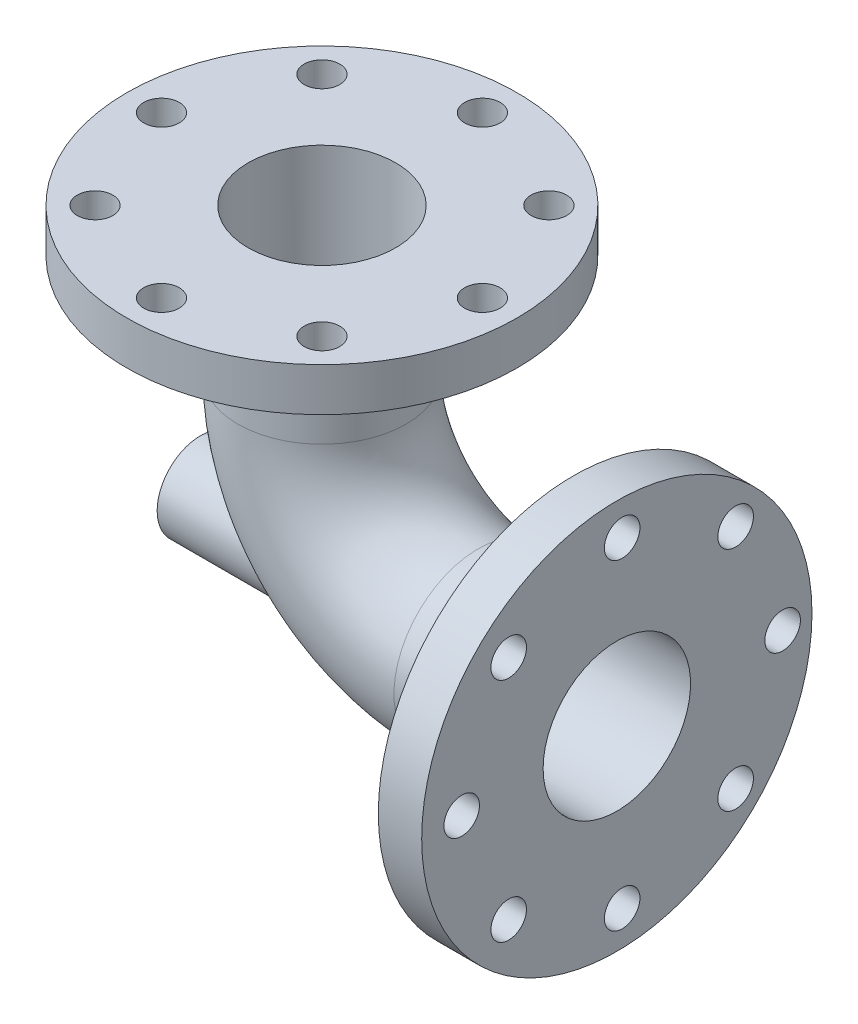
from build123d import *

# Parameters (mm, degrees)
SWEEP1_PROFILE_R     = 48.5
SKETCH25_R           = 112.5
BOSS_EXTRUDE1_DEPTH  = 25
SKETCH26_R           = 112.5
BOSS_EXTRUDE2_DEPTH  = 25
SWEEP2_PROFILE_R     = 25
CUT_SWEEP2_PROFILE_R = 42.5
CUT_SWEEP3_PROFILE_R = 9
SKETCH48_R           = 12
CUT_EXTRUDE1_DEPTH   = 12
CUT_EXTRUDE2_REACH   = 354.438
SKETCH55_R           = 10.25
CUT_EXTRUDE3_REACH   = 352.838
SKETCH56_R           = 10.25


with BuildPart() as part:
    # Sweep1: sweep along a path in Sketch2
    with BuildLine(Plane.XY) as sweep1_path:
        Line((0, 175), (0, 90))
        ThreePointArc((0, 90), (26.360389693, 26.360389693), (90, 0))
        Line((90, 0), (170, 0))
    # Sweep1 profile (on start of the path) → Sweep1 (sweep)
    with BuildSketch(Plane(origin=(0, 175, 0), x_dir=(-1, 0, 0), z_dir=(0, -1, 0))):
        Circle(SWEEP1_PROFILE_R)
    sweep(path=sweep1_path.line)

    # Sketch25 → Boss-Extrude1 (add)
    with BuildSketch(Plane(origin=(0, 175, 0), x_dir=(1, 0, 0), z_dir=(0, 1, 0))):
        Circle(SKETCH25_R)
    extrude(amount=-BOSS_EXTRUDE1_DEPTH)

    # Sketch26 → Boss-Extrude2 (add)
    with BuildSketch(Plane(origin=(170, 0, 0), x_dir=(0, 0, -1), z_dir=(1, 0, 0))):
        Circle(SKETCH26_R)
    extrude(amount=-BOSS_EXTRUDE2_DEPTH)

    # Sweep2: sweep along a path in Sketch27
    with BuildLine(Plane(origin=(0, 0, 0), x_dir=(1, 0, 0), z_dir=(0, 1, 0))) as sweep2_path:
        Line((170, 0), (-70, 0))
    # Sweep2 profile (on start of the path) → Sweep2 (sweep)
    with BuildSketch(Plane(origin=(170, 0, 0), x_dir=(0, 0, -1), z_dir=(-1, 0, 0))):
        Circle(SWEEP2_PROFILE_R)
    sweep(path=sweep2_path.line)

    # Cut-Sweep2: sweep along a path in Sketch2<2>
    with BuildLine(Plane.XY) as cut_sweep2_path:
        Line((0, 175), (0, 90))
        ThreePointArc((0, 90), (26.360389693, 26.360389693), (90, 0))
        Line((90, 0), (170, 0))
    # Cut-Sweep2 profile (on start of the path) → Cut-Sweep2 (sweep, cut)
    with BuildSketch(Plane(origin=(0, 175, 0), x_dir=(-1, 0, 0), z_dir=(0, -1, 0))):
        Circle(CUT_SWEEP2_PROFILE_R)
    sweep(path=cut_sweep2_path.line, mode=Mode.SUBTRACT)

    # Cut-Sweep3: sweep along a path in Sketch27<4>
    with BuildLine(Plane(origin=(0, 0, 0), x_dir=(1, 0, 0), z_dir=(0, 1, 0))) as cut_sweep3_path:
        Line((170, 0), (-70, 0))
    # Cut-Sweep3 profile (on start of the path) → Cut-Sweep3 (sweep, cut)
    with BuildSketch(Plane(origin=(170, 0, 0), x_dir=(0, 0, -1), z_dir=(-1, 0, 0))):
        Circle(CUT_SWEEP3_PROFILE_R)
    sweep(path=cut_sweep3_path.line, mode=Mode.SUBTRACT)

    # Sketch48 → Cut-Extrude1 (cut)
    with BuildSketch(Plane.ZY.offset(70)):
        Circle(SKETCH48_R)
    extrude(amount=-CUT_EXTRUDE1_DEPTH, mode=Mode.SUBTRACT)

    # Sketch55 → Cut-Extrude2 (cut, up to next)
    with BuildSketch(Plane(origin=(0, 175, 0), x_dir=(1, 0, 0), z_dir=(0, 1, 0)), mode=Mode.PRIVATE) as cut_extrude2_sk1:
        with Locations((-92.5, 0)):
            Circle(SKETCH55_R)
    cut_extrude2_tool1 = extrude(cut_extrude2_sk1.sketch, amount=-CUT_EXTRUDE2_REACH, mode=Mode.PRIVATE) & part.part
    # Sketch55 → Cut-Extrude2 (cut, up to next)
    with BuildSketch(Plane(origin=(0, 175, 0), x_dir=(1, 0, 0), z_dir=(0, 1, 0)), mode=Mode.PRIVATE) as cut_extrude2_sk2:
        with Locations((-65.40737726, 65.40737726)):
            Circle(SKETCH55_R)
    cut_extrude2_tool2 = extrude(cut_extrude2_sk2.sketch, amount=-CUT_EXTRUDE2_REACH, mode=Mode.PRIVATE) & part.part
    # Sketch55 → Cut-Extrude2 (cut, up to next)
    with BuildSketch(Plane(origin=(0, 175, 0), x_dir=(1, 0, 0), z_dir=(0, 1, 0)), mode=Mode.PRIVATE) as cut_extrude2_sk3:
        with Locations((0, 92.5)):
            Circle(SKETCH55_R)
    cut_extrude2_tool3 = extrude(cut_extrude2_sk3.sketch, amount=-CUT_EXTRUDE2_REACH, mode=Mode.PRIVATE) & part.part
    # Sketch55 → Cut-Extrude2 (cut, up to next)
    with BuildSketch(Plane(origin=(0, 175, 0), x_dir=(1, 0, 0), z_dir=(0, 1, 0)), mode=Mode.PRIVATE) as cut_extrude2_sk4:
        with Locations((65.40737726, 65.40737726)):
            Circle(SKETCH55_R)
    cut_extrude2_tool4 = extrude(cut_extrude2_sk4.sketch, amount=-CUT_EXTRUDE2_REACH, mode=Mode.PRIVATE) & part.part
    # Sketch55 → Cut-Extrude2 (cut, up to next)
    with BuildSketch(Plane(origin=(0, 175, 0), x_dir=(1, 0, 0), z_dir=(0, 1, 0)), mode=Mode.PRIVATE) as cut_extrude2_sk5:
        with Locations((92.5, 0)):
            Circle(SKETCH55_R)
    cut_extrude2_tool5 = extrude(cut_extrude2_sk5.sketch, amount=-CUT_EXTRUDE2_REACH, mode=Mode.PRIVATE) & part.part
    # Sketch55 → Cut-Extrude2 (cut, up to next)
    with BuildSketch(Plane(origin=(0, 175, 0), x_dir=(1, 0, 0), z_dir=(0, 1, 0)), mode=Mode.PRIVATE) as cut_extrude2_sk6:
        with Locations((65.40737726, -65.40737726)):
            Circle(SKETCH55_R)
    cut_extrude2_tool6 = extrude(cut_extrude2_sk6.sketch, amount=-CUT_EXTRUDE2_REACH, mode=Mode.PRIVATE) & part.part
    # Sketch55 → Cut-Extrude2 (cut, up to next)
    with BuildSketch(Plane(origin=(0, 175, 0), x_dir=(1, 0, 0), z_dir=(0, 1, 0)), mode=Mode.PRIVATE) as cut_extrude2_sk7:
        with Locations((0, -92.5)):
            Circle(SKETCH55_R)
    cut_extrude2_tool7 = extrude(cut_extrude2_sk7.sketch, amount=-CUT_EXTRUDE2_REACH, mode=Mode.PRIVATE) & part.part
    # Sketch55 → Cut-Extrude2 (cut, up to next)
    with BuildSketch(Plane(origin=(0, 175, 0), x_dir=(1, 0, 0), z_dir=(0, 1, 0)), mode=Mode.PRIVATE) as cut_extrude2_sk8:
        with Locations((-65.40737726, -65.40737726)):
            Circle(SKETCH55_R)
    cut_extrude2_tool8 = extrude(cut_extrude2_sk8.sketch, amount=-CUT_EXTRUDE2_REACH, mode=Mode.PRIVATE) & part.part
    add(cut_extrude2_tool1.solids().sort_by_distance((-92.5, 175, 0))[0], mode=Mode.SUBTRACT)
    add(cut_extrude2_tool2.solids().sort_by_distance((-65.407377, 175, -65.407377))[0], mode=Mode.SUBTRACT)
    add(cut_extrude2_tool3.solids().sort_by_distance((0, 175, -92.5))[0], mode=Mode.SUBTRACT)
    add(cut_extrude2_tool4.solids().sort_by_distance((65.407377, 175, -65.407377))[0], mode=Mode.SUBTRACT)
    add(cut_extrude2_tool5.solids().sort_by_distance((92.5, 175, 0))[0], mode=Mode.SUBTRACT)
    add(cut_extrude2_tool6.solids().sort_by_distance((65.407377, 175, 65.407377))[0], mode=Mode.SUBTRACT)
    add(cut_extrude2_tool7.solids().sort_by_distance((0, 175, 92.5))[0], mode=Mode.SUBTRACT)
    add(cut_extrude2_tool8.solids().sort_by_distance((-65.407377, 175, 65.407377))[0], mode=Mode.SUBTRACT)

    # Sketch56 → Cut-Extrude3 (cut, up to next)
    with BuildSketch(Plane(origin=(170, 0, 0), x_dir=(0, 0, -1), z_dir=(1, 0, 0)), mode=Mode.PRIVATE) as cut_extrude3_sk1:
        with Locations((-89.428156387, 0)):
            Circle(SKETCH56_R)
    cut_extrude3_tool1 = extrude(cut_extrude3_sk1.sketch, amount=-CUT_EXTRUDE3_REACH, mode=Mode.PRIVATE) & part.part
    # Sketch56 → Cut-Extrude3 (cut, up to next)
    with BuildSketch(Plane(origin=(170, 0, 0), x_dir=(0, 0, -1), z_dir=(1, 0, 0)), mode=Mode.PRIVATE) as cut_extrude3_sk2:
        with Locations((-62.335533646, 65.40737726)):
            Circle(SKETCH56_R)
    cut_extrude3_tool2 = extrude(cut_extrude3_sk2.sketch, amount=-CUT_EXTRUDE3_REACH, mode=Mode.PRIVATE) & part.part
    # Sketch56 → Cut-Extrude3 (cut, up to next)
    with BuildSketch(Plane(origin=(170, 0, 0), x_dir=(0, 0, -1), z_dir=(1, 0, 0)), mode=Mode.PRIVATE) as cut_extrude3_sk3:
        with Locations((3.071843613, 92.5)):
            Circle(SKETCH56_R)
    cut_extrude3_tool3 = extrude(cut_extrude3_sk3.sketch, amount=-CUT_EXTRUDE3_REACH, mode=Mode.PRIVATE) & part.part
    # Sketch56 → Cut-Extrude3 (cut, up to next)
    with BuildSketch(Plane(origin=(170, 0, 0), x_dir=(0, 0, -1), z_dir=(1, 0, 0)), mode=Mode.PRIVATE) as cut_extrude3_sk4:
        with Locations((68.479220873, 65.40737726)):
            Circle(SKETCH56_R)
    cut_extrude3_tool4 = extrude(cut_extrude3_sk4.sketch, amount=-CUT_EXTRUDE3_REACH, mode=Mode.PRIVATE) & part.part
    # Sketch56 → Cut-Extrude3 (cut, up to next)
    with BuildSketch(Plane(origin=(170, 0, 0), x_dir=(0, 0, -1), z_dir=(1, 0, 0)), mode=Mode.PRIVATE) as cut_extrude3_sk5:
        with Locations((95.571843613, 0)):
            Circle(SKETCH56_R)
    cut_extrude3_tool5 = extrude(cut_extrude3_sk5.sketch, amount=-CUT_EXTRUDE3_REACH, mode=Mode.PRIVATE) & part.part
    # Sketch56 → Cut-Extrude3 (cut, up to next)
    with BuildSketch(Plane(origin=(170, 0, 0), x_dir=(0, 0, -1), z_dir=(1, 0, 0)), mode=Mode.PRIVATE) as cut_extrude3_sk6:
        with Locations((68.479220873, -65.40737726)):
            Circle(SKETCH56_R)
    cut_extrude3_tool6 = extrude(cut_extrude3_sk6.sketch, amount=-CUT_EXTRUDE3_REACH, mode=Mode.PRIVATE) & part.part
    # Sketch56 → Cut-Extrude3 (cut, up to next)
    with BuildSketch(Plane(origin=(170, 0, 0), x_dir=(0, 0, -1), z_dir=(1, 0, 0)), mode=Mode.PRIVATE) as cut_extrude3_sk7:
        with Locations((3.071843613, -92.5)):
            Circle(SKETCH56_R)
    cut_extrude3_tool7 = extrude(cut_extrude3_sk7.sketch, amount=-CUT_EXTRUDE3_REACH, mode=Mode.PRIVATE) & part.part
    # Sketch56 → Cut-Extrude3 (cut, up to next)
    with BuildSketch(Plane(origin=(170, 0, 0), x_dir=(0, 0, -1), z_dir=(1, 0, 0)), mode=Mode.PRIVATE) as cut_extrude3_sk8:
        with Locations((-62.335533646, -65.40737726)):
            Circle(SKETCH56_R)
    cut_extrude3_tool8 = extrude(cut_extrude3_sk8.sketch, amount=-CUT_EXTRUDE3_REACH, mode=Mode.PRIVATE) & part.part
    add(cut_extrude3_tool1.solids().sort_by_distance((170, 0, 89.428156))[0], mode=Mode.SUBTRACT)
    add(cut_extrude3_tool2.solids().sort_by_distance((170, 65.407377, 62.335534))[0], mode=Mode.SUBTRACT)
    add(cut_extrude3_tool3.solids().sort_by_distance((170, 92.5, -3.071844))[0], mode=Mode.SUBTRACT)
    add(cut_extrude3_tool4.solids().sort_by_distance((170, 65.407377, -68.479221))[0], mode=Mode.SUBTRACT)
    add(cut_extrude3_tool5.solids().sort_by_distance((170, 0, -95.571844))[0], mode=Mode.SUBTRACT)
    add(cut_extrude3_tool6.solids().sort_by_distance((170, -65.407377, -68.479221))[0], mode=Mode.SUBTRACT)
    add(cut_extrude3_tool7.solids().sort_by_distance((170, -92.5, -3.071844))[0], mode=Mode.SUBTRACT)
    add(cut_extrude3_tool8.solids().sort_by_distance((170, -65.407377, 62.335534))[0], mode=Mode.SUBTRACT)


solid = part.part
